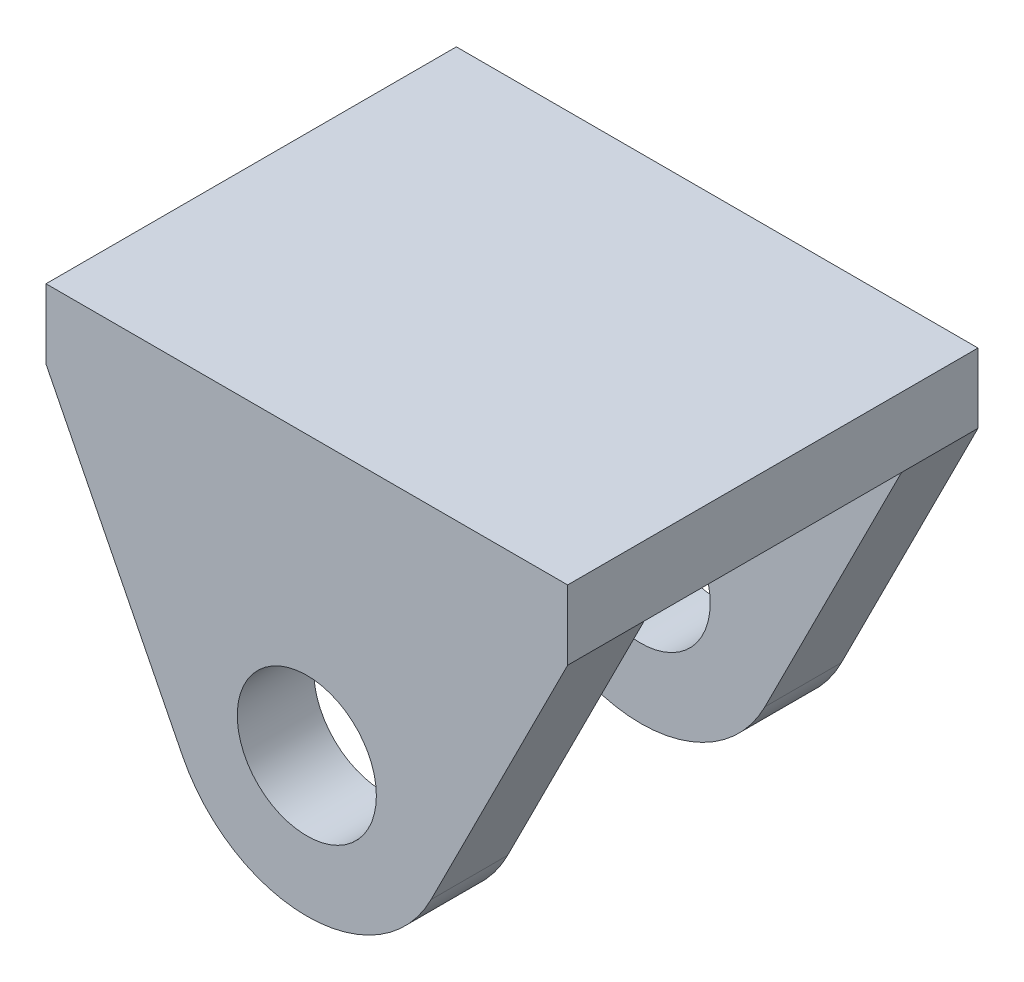
from build123d import *

# Parameters (mm, degrees)
SKETCH1_R           = 10
BOSS_EXTRUDE1_DEPTH = 11
SKETCH1_3_W         = 75
SKETCH1_3_H         = 10
BOSS_EXTRUDE2_DEPTH = 59


with BuildPart() as part:
    # Sketch1 → Boss-Extrude1 (new body)
    with BuildSketch(Plane.XY):
        with BuildLine():
            Line((37.5, 30), (-37.5, 30))
            Line((-37.5, 30), (-17.862926307, -8.99532455))
            ThreePointArc((-17.862926307, -8.99532455), (0, -20), (17.862926307, -8.99532455))
            Line((17.862926307, -8.99532455), (37.5, 30))
        make_face()
        Circle(SKETCH1_R, mode=Mode.SUBTRACT)
    boss_extrude1 = extrude(amount=-BOSS_EXTRUDE1_DEPTH)

    # Sketch1<3> → Boss-Extrude2 (add)
    with BuildSketch(Plane.XY):
        with Locations((0, 35)):
            Rectangle(SKETCH1_3_W, SKETCH1_3_H)
    extrude(amount=-BOSS_EXTRUDE2_DEPTH)

    # Mirror2: Boss-Extrude1 across plane
    add(boss_extrude1.mirror(Plane.XY.offset(-29.5)))


solid = part.part
